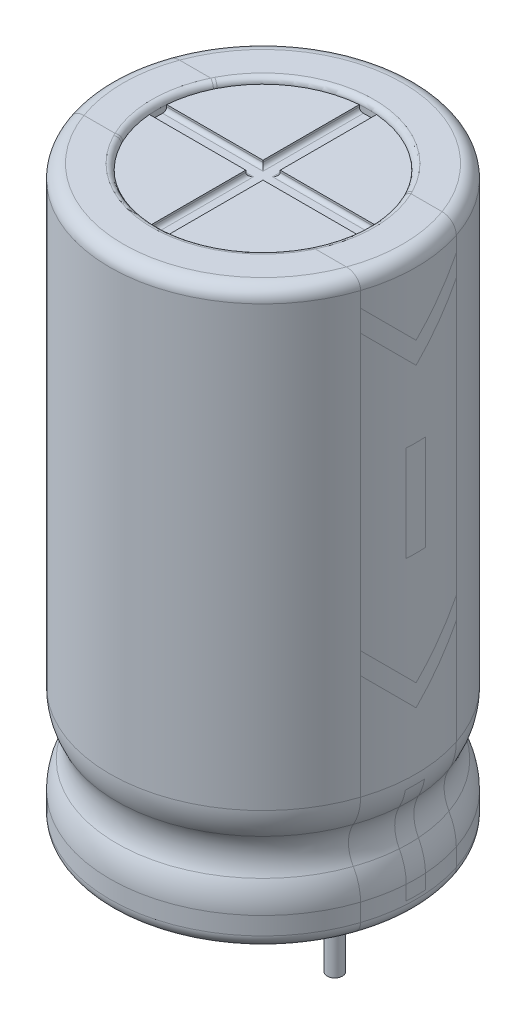
from build123d import *

# Parameters (mm, degrees)
FILLET_1_R          = 3
SKETCH_2_R          = 5.5
CUT_EXTRUDE_1_DEPTH = 0.3
CUT_EXTRUDE_2_DEPTH = 0.3
FILLET_2_R          = 0.2
FILLET_3_R          = 0.7
FILLET_4_R          = 0.7
CUT_EXTRUDE_START   = -0.3
SKETCH_4_R          = 5.5
CUT_EXTRUDE_3_DEPTH = 0.3
SKETCH_5_R          = 0.4
EXTRUDE_1_DEPTH     = 5
FILLET_5_R          = 0.3
FILLET_6_R          = 0.3


with BuildPart() as part:
    # Эскиз1 → Повернуть1 (revolve)
    with BuildSketch(Plane.XY, mode=Mode.PRIVATE) as revolve_1_sk:
        with BuildLine():
            Line((0, 0), (-8, 0))
            Line((-8, 0), (-8, 2.571714314))
            ThreePointArc((-8, 2.571714314), (-7.4, 4), (-8, 5.428285686))
            Line((-8, 5.428285686), (-8, 30))
            Line((-8, 30), (0, 30))
            Line((0, 30), (0, 0))
        make_face()
    revolve(revolve_1_sk.sketch.rotate(Axis((0, 30.497916687, 0), (0, -1, 0)), 270), axis=Axis((0, 30.497916687, 0), (0, -1, 0)))

    # Скругление1
    fillet_1_edges = [part.edges().sort_by_distance(p)[0] for p in [
        (0, 2.571714314, -8),
        (0, 5.428285686, -8),
    ]]
    fillet(fillet_1_edges, radius=FILLET_1_R)

    # Эскиз2 → Вырез-Вытянуть1 (cut)
    with BuildSketch(Plane(origin=(0, 30, 0), x_dir=(1, 0, 0), z_dir=(0, 1, 0))):
        with Locations(Location((0, 0, 0), (0, 0, 270))):
            Circle(SKETCH_2_R)
    extrude(amount=-CUT_EXTRUDE_1_DEPTH, mode=Mode.SUBTRACT)

    # Эскиз3 → Вырез-Вытянуть2 (cut)
    with BuildSketch(Plane(origin=(0, 29.7, 0), x_dir=(1, 0, 0), z_dir=(0, 1, 0))):
        with BuildLine():
            Line((-0.45, 5.481559997), (-0.45, 0.45))
            Line((-0.45, 0.45), (-5.481559997, 0.45))
            ThreePointArc((-5.481559997, 0.45), (-5.5, 0), (-5.481559997, -0.45))
            Line((-5.481559997, -0.45), (-0.45, -0.45))
            Line((-0.45, -0.45), (-0.45, -5.481559997))
            ThreePointArc((-0.45, -5.481559997), (0, -5.5), (0.45, -5.481559997))
            Line((0.45, -5.481559997), (0.45, -0.45))
            Line((0.45, -0.45), (5.481559997, -0.45))
            ThreePointArc((5.481559997, -0.45), (5.5, 0), (5.481559997, 0.45))
            Line((5.481559997, 0.45), (0.45, 0.45))
            Line((0.45, 0.45), (0.45, 5.481559997))
            ThreePointArc((0.45, 5.481559997), (0, 5.5), (-0.45, 5.481559997))
        make_face()
    extrude(amount=-CUT_EXTRUDE_2_DEPTH, mode=Mode.SUBTRACT)

    # Скругление2
    fillet_2_edges = [part.edges().sort_by_distance(p)[0] for p in [
        (0.45, 29.4, -2.965779998),
        (2.965779998, 29.4, -0.45),
        (2.965779998, 29.4, 0.45),
        (0.45, 29.4, 2.965779998),
        (-0.45, 29.4, 2.965779998),
        (-2.965779998, 29.4, 0.45),
        (-2.965779998, 29.4, -0.45),
        (-0.45, 29.4, -2.965779998),
    ]]
    fillet(fillet_2_edges, radius=FILLET_2_R)

    # Скругление3
    fillet_3_edges = [part.edges().sort_by_distance(p)[0] for p in [
        (0, 30, -8),
    ]]
    fillet(fillet_3_edges, radius=FILLET_3_R)

    # Скругление4
    fillet_4_edges = [part.edges().sort_by_distance(p)[0] for p in [
        (0, 0, -8),
    ]]
    fillet(fillet_4_edges, radius=FILLET_4_R)

    # Эскиз4 → Вырез-Вытянуть3 (cut)
    with BuildSketch(Plane.XZ.offset(CUT_EXTRUDE_START)):
        with Locations(Location((0, 0, 0), (0, 0, 90))):
            Circle(SKETCH_4_R)
    extrude(amount=CUT_EXTRUDE_3_DEPTH, mode=Mode.SUBTRACT)

    # Эскиз5 → Бобышка-Вытянуть1 (add)
    with BuildSketch(Plane.XZ.offset(-0.3)):
        with Locations(Location((-3.75, 0, 0), (0, 0, 270))):
            Circle(SKETCH_5_R)
        with Locations(Location((3.75, 0, 0), (0, 0, 90))):
            Circle(SKETCH_5_R)
    extrude(amount=EXTRUDE_1_DEPTH)

    # Скругление5
    fillet_5_edges = [part.edges().sort_by_distance(p)[0] for p in [
        (0, 30, -5.5),
    ]]
    fillet(fillet_5_edges, radius=FILLET_5_R - 0.0001)  # a hair under: the kernel refuses the full size

    # Скругление6
    fillet_6_edges = [part.edges().sort_by_distance(p)[0] for p in [
        (0, 0, -5.5),
    ]]
    fillet(fillet_6_edges, radius=FILLET_6_R - 0.0001)  # a hair under: the kernel refuses the full size


solid = part.part
